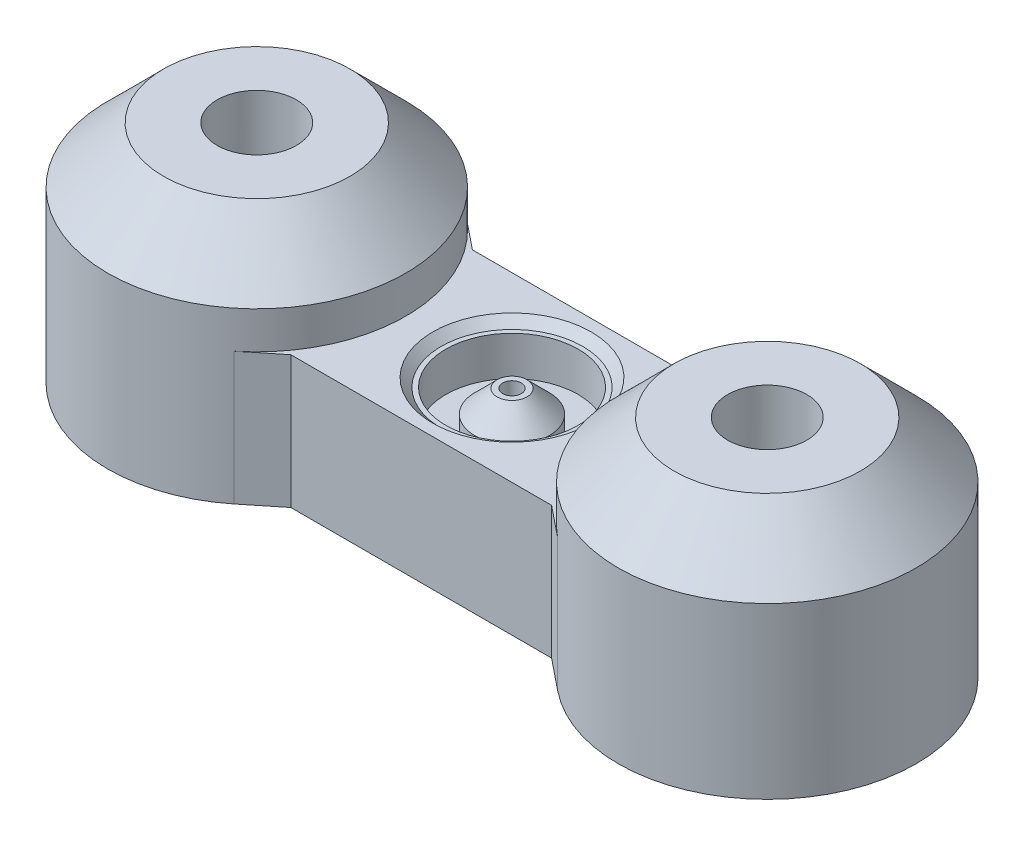
from build123d import *

# Parameters (mm, degrees)
BOSS_EXTRUDE3_START = -7.103375673
SKETCH4_R           = 2.125
SKETCH4_R_2         = 4.25
BOSS_EXTRUDE3_DEPTH = 7.103375673
BOSS_EXTRUDE4_START = 5
SKETCH6_R           = 8
SKETCH6_R_2         = 2.125
BOSS_EXTRUDE4_DEPTH = 5
SKETCH5_R           = 4
CUT_EXTRUDE2_DEPTH  = 9.103375673
CHAMFER2_SIZE       = 1.154700538
CHAMFER2_SIZE_2     = 2
CHAMFER3_SIZE       = 3


# Read off the part's stored shape, not the designer's step: Revolve1
with BuildPart() as part:
    # Revolve1 outline → Revolve1 (revolve)
    with BuildSketch(Plane.XY):
        Polygon((4.25, 0), (3.8, -0.45), (3.55, -0.45), (3.55, -2.56), (2, -2.56), (2, -1.7), (0.8, -0.5), (0.5, -0.5), (0.5, -3.56), (3, -5.003375673), (3, -6.353375673), (2, -6.353375673), (3.299038106, -7.103375673), (4.25, -7.103375673), align=None)
    revolve(axis=Axis((0, 0, 0), (0, 1, 0)))

    # Sketch4 → Boss-Extrude3 (add)
    with BuildSketch(Plane.XZ.offset(7.103375673).offset(BOSS_EXTRUDE3_START)):
        with BuildLine():
            Line((-7, 4.875), (7, 4.875))
            Line((7, 4.875), (8.680016564, 6.228945842))
            ThreePointArc((8.680016564, 6.228945842), (21.7, 0), (8.680016564, -6.228945842))
            Line((8.680016564, -6.228945842), (7, -4.875))
            Line((7, -4.875), (-7, -4.875))
            Line((-7, -4.875), (-8.680016564, -6.228945842))
            ThreePointArc((-8.680016564, -6.228945842), (-21.7, 0), (-8.680016564, 6.228945842))
            Line((-8.680016564, 6.228945842), (-7, 4.875))
        make_face()
        with Locations(Location((-13.7, 0, 0), (0, 0, 270))):
            Circle(SKETCH4_R, mode=Mode.SUBTRACT)
        with Locations(Location((13.7, 0, 0), (0, 0, 270))):
            Circle(SKETCH4_R, mode=Mode.SUBTRACT)
        Circle(SKETCH4_R_2, mode=Mode.SUBTRACT)
    extrude(amount=BOSS_EXTRUDE3_DEPTH)

    # Sketch6 → Boss-Extrude4 (add)
    # profile 1 of 2: a face of its own
    with BuildSketch(Plane(origin=(0, 0, 0), x_dir=(1, 0, 0), z_dir=(0, 1, 0)).offset(BOSS_EXTRUDE4_START)):
        with Locations(Location((-13.7, 0, 0), (0, 0, 51.134235394))):
            Circle(SKETCH6_R)
        with Locations(Location((-13.7, 0, 0), (0, 0, 90))):
            Circle(SKETCH6_R_2, mode=Mode.SUBTRACT)
    # profile 2 of 2: a face of its own
    with BuildSketch(Plane(origin=(0, 0, 0), x_dir=(1, 0, 0), z_dir=(0, 1, 0)).offset(BOSS_EXTRUDE4_START)):
        with Locations(Location((13.7, 0, 0), (0, 0, 128.865764606))):
            Circle(SKETCH6_R)
        with Locations(Location((13.7, 0, 0), (0, 0, 90))):
            Circle(SKETCH6_R_2, mode=Mode.SUBTRACT)
    extrude(amount=-BOSS_EXTRUDE4_DEPTH)

    # Sketch5 → Cut-Extrude2 (cut)
    with BuildSketch(Plane.XZ.offset(7.103375673)):
        with Locations(Location((-13.699999648, 0, 0), (0, 0, 270))):
            Circle(SKETCH5_R)
        with Locations(Location((13.7, 0, 0), (0, 0, 270))):
            Circle(SKETCH5_R)
    extrude(amount=-CUT_EXTRUDE2_DEPTH, mode=Mode.SUBTRACT)

    # Chamfer2
    # the kernel refuses this chamfer: 2, 1.154700538 mm, written as the material it adds along each edge
    with BuildSketch(Plane(origin=(-13.699999648, 2, 0), x_dir=(0, 0, -1), z_dir=(-1, 0, 0))) as chamfer2_piece_1_section:
        Polygon((4, CHAMFER2_SIZE), (4 - CHAMFER2_SIZE_2, 0), (4, 0), align=None)
    chamfer2_piece_1 = revolve(axis=Axis((-13.699999648, 2, 0), (0, -1, 0)), mode=Mode.PRIVATE)
    chamfer2_piece_1 = chamfer2_piece_1 - Plane(origin=(-13.7, 1.411589212, 0), x_dir=(0, 0, -1), z_dir=(0, 1, 0)) * Cylinder(2.125, 17, mode=Mode.PRIVATE)
    add(chamfer2_piece_1)
    with BuildSketch(Plane(origin=(13.7, 2, 0), x_dir=(0, 0, -1), z_dir=(-1, 0, 0))) as chamfer2_piece_2_section:
        Polygon((4, CHAMFER2_SIZE), (4 - CHAMFER2_SIZE_2, 0), (4, 0), align=None)
    chamfer2_piece_2 = revolve(axis=Axis((13.7, 2, 0), (0, -1, 0)), mode=Mode.PRIVATE)
    chamfer2_piece_2 = chamfer2_piece_2 - Plane(origin=(13.7, 1.41158911, 0), x_dir=(0, 0, -1), z_dir=(0, 1, 0)) * Cylinder(2.125, 16, mode=Mode.PRIVATE)
    add(chamfer2_piece_2)

    # Chamfer3
    chamfer3_edges = [part.edges().sort_by_distance(p)[0] for p in [
        (-18.719983436, 5, 6.228945842),
        (18.719983436, 5, 6.228945842),
    ]]
    chamfer(chamfer3_edges, length=CHAMFER3_SIZE)


solid = part.part
